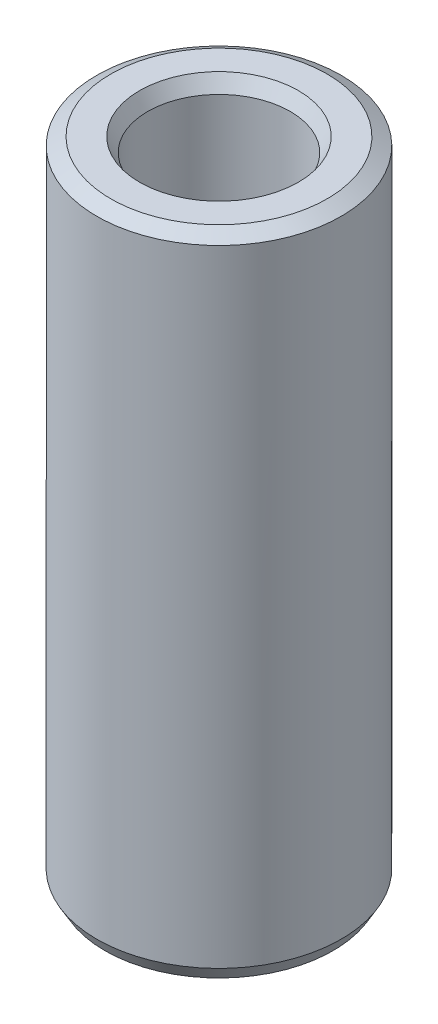
from build123d import *
from OCP.BRepFilletAPI import BRepFilletAPI_MakeChamfer

# Parameters (mm, degrees)
SKETCH1_R           = 42.5
BOSS_EXTRUDE1_DEPTH = 225.431002696
SKETCH2_R           = 24.800240578
CUT_EXTRUDE1_DEPTH  = 234.305887145
CHAMFER1_SIZE       = 2.81611642
CHAMFER1_SIZE2      = 4.877656719


with BuildPart() as part:
    # Sketch1 → Boss-Extrude1 (new body)
    with BuildSketch(Plane(origin=(0, 0, 0), x_dir=(1, 0, 0), z_dir=(0, 1, 0))):
        Circle(SKETCH1_R)
    extrude(amount=BOSS_EXTRUDE1_DEPTH)

    # Sketch2 → Cut-Extrude1 (cut, through all)
    with BuildSketch(Plane(origin=(0, 0, 0), x_dir=(1, 0, 0), z_dir=(0, 1, 0))):
        Circle(SKETCH2_R)
    extrude(amount=CUT_EXTRUDE1_DEPTH, mode=Mode.SUBTRACT)

    # Chamfer1: one chamfer whose edges measure the first distance from different faces: ONE call of the kernel's chamfer builder (chamfer() names one face for all edges)
    chamfer1_edges_1 = [part.edges().sort_by_distance(p)[0] for p in [
        (-24.800240578, 225.431002696, 0),
    ]]
    chamfer1_side_1 = [part.faces().sort_by_distance(p)[0] for p in [
        (-41.297918472, 225.431002696, 0),
    ]]
    chamfer1_edges_2 = [part.edges().sort_by_distance(p)[0] for p in [
        (-24.800240578, 0, 0),
    ]]
    chamfer1_side_2 = [part.faces().sort_by_distance(p)[0] for p in [
        (-24.800240578, 112.715501348, 0),
    ]]
    chamfer1_edges_3 = [part.edges().sort_by_distance(p)[0] for p in [
        (-42.5, 0, 0),
    ]]
    chamfer1_side_3 = [part.faces().sort_by_distance(p)[0] for p in [
        (-41.297918472, 0, 0),
    ]]
    chamfer1_edges_4 = [part.edges().sort_by_distance(p)[0] for p in [
        (-42.5, 225.431002696, 0),
    ]]
    chamfer1_side_4 = [part.faces().sort_by_distance(p)[0] for p in [
        (-42.5, 112.715501348, 0),
    ]]
    chamfer1 = BRepFilletAPI_MakeChamfer(part.part.solid().wrapped)
    for e in chamfer1_edges_1:
        chamfer1.Add(CHAMFER1_SIZE, CHAMFER1_SIZE2, e.wrapped, chamfer1_side_1[0].wrapped)  # the first distance lies on this face
    for e in chamfer1_edges_2:
        chamfer1.Add(CHAMFER1_SIZE, CHAMFER1_SIZE2, e.wrapped, chamfer1_side_2[0].wrapped)  # the first distance lies on this face
    for e in chamfer1_edges_3:
        chamfer1.Add(CHAMFER1_SIZE, CHAMFER1_SIZE2, e.wrapped, chamfer1_side_3[0].wrapped)  # the first distance lies on this face
    for e in chamfer1_edges_4:
        chamfer1.Add(CHAMFER1_SIZE, CHAMFER1_SIZE2, e.wrapped, chamfer1_side_4[0].wrapped)  # the first distance lies on this face
    add(Compound.cast(chamfer1.Shape()), mode=Mode.REPLACE)


solid = part.part
